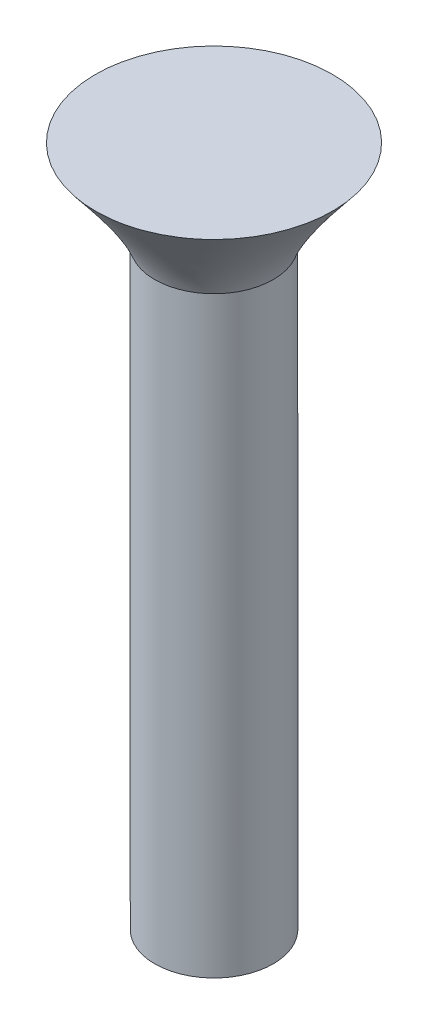
from build123d import *

# Parameters (mm, degrees)
SKETCH1_R           = 2
BOSS_EXTRUDE1_DEPTH = 20


with BuildPart() as part:
    # Sketch1 → Boss-Extrude1 (new body)
    with BuildSketch(Plane(origin=(0, 0, 0), x_dir=(1, 0, 0), z_dir=(0, 1, 0))):
        with Locations(Location((0, 0, 0), (0, 0, 270))):
            Circle(SKETCH1_R)
    extrude(amount=BOSS_EXTRUDE1_DEPTH)

    # Loft1: read off the stored shape, not the designer's step
    # Loft1: loft between two sections, ruled curve by curve
    loft1_from = [
        Edge.make_bspline([(-1.822806553, 20, -0.823028717), (-3.468863988, 20, 2.822584389), (0.176749119, 20, 4.468641824), (1.822806553, 20, 0.823028717), (3.468863988, 20, -2.822584389), (-0.176749119, 20, -4.468641824), (-1.822806553, 20, -0.823028717)], [0, 0, 0, 0, 0.5, 0.5, 0.5, 1, 1, 1, 1], 3, [1, 0.333333333, 0.333333333, 1, 0.333333333, 0.333333333, 1]),
    ]
    loft1_to = [
        Edge.make_bspline([(-1.802513065, 23.000000096, -3.57084677), (-8.944206604, 23.000000096, 0.034179359), (-5.339180475, 23.000000096, 7.175872899), (1.802513065, 23.000000096, 3.57084677), (8.944206604, 23.000000096, -0.034179359), (5.339180475, 23.000000096, -7.175872899), (-1.802513065, 23.000000096, -3.57084677)], [0, 0, 0, 0, 0.5, 0.5, 0.5, 1, 1, 1, 1], 3, [1, 0.333333333, 0.333333333, 1, 0.333333333, 0.333333333, 1]),
    ]
    loft1 = Solid(Shell([*[Face.make_surface_from_curves(loft1_from[k], loft1_to[k]) for k in range(1)], Face(Wire(loft1_from)), Face(Wire(loft1_to))]))
    add(loft1)


solid = part.part
